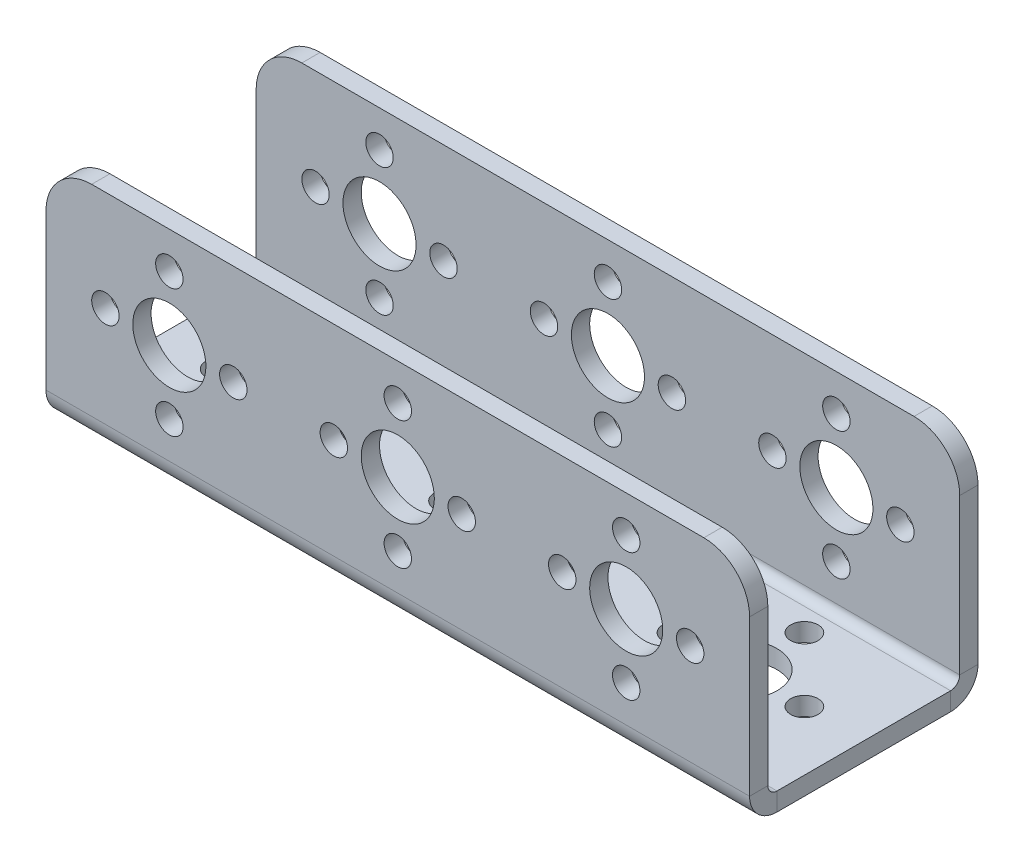
from build123d import *

# Parameters (mm, degrees)
T_LE_DE_BASE_PLI_E1_DEPTH              = 38.5
ESQUISSE7_W                            = 4
ESQUISSE7_H                            = 12.501
ESQUISSE12_W                           = 1.5
ESQUISSE12_H                           = 12.501
DIAM_TRE_DU_PER_AGE_3_0_3_1_AT_2_COUNT = 2
DIAM_TRE_DU_PER_AGE_3_0_3_1_AT_2_PITCH = 9.899494937
DIAM_TRE_DU_PER_AGE_3_0_3_1_AT_3_COUNT = 2
DIAM_TRE_DU_PER_AGE_3_0_3_1_AT_3_PITCH = 14
DIAM_TRE_DU_PER_AGE_3_0_3_1_AT_4_COUNT = 2
DIAM_TRE_DU_PER_AGE_3_0_3_1_AT_4_PITCH = 9.899494937
R_P_TITION_START                       = 10.5
R_P_TITION_CIRCULAIRE1_OUTLINE_R       = 4
R_P_TITION_CIRCULAIRE1_OUTLINE_R_2     = 1.5
R_P_TITION_CIRCULAIRE1_DEPTH           = 2
R_P_TITION_CIRCULAIRE1_2_OUTLINE_R     = 4
R_P_TITION_CIRCULAIRE1_2_OUTLINE_R_2   = 1.5
R_P_TITION_CIRCULAIRE1_2_DEPTH         = 2
R_P_TITION_LIN_AIRE1_COUNT             = 3
R_P_TITION_LIN_AIRE1_PITCH             = 25
R_P_TITION_LIN_AIRE1_COPY_1_SKETCH_W   = 1.5
R_P_TITION_LIN_AIRE1_COPY_1_SKETCH_H   = 12.501
R_P_TITION_LIN_AIRE1_COPY_2_SKETCH_W   = 1.5
R_P_TITION_LIN_AIRE1_COPY_2_SKETCH_H   = 12.501
R_P_TITION_LIN_AIRE1_COPY_3_SKETCH_W   = 1.5
R_P_TITION_LIN_AIRE1_COPY_3_SKETCH_H   = 12.501
R_P_TITION_LIN_AIRE1_COPY_4_SKETCH_W   = 1.5
R_P_TITION_LIN_AIRE1_COPY_4_SKETCH_H   = 12.501
R_P_TITION_LIN_AIRE1_COPY_5_SKETCH_W   = 1.5
R_P_TITION_LIN_AIRE1_COPY_5_SKETCH_H   = 12.501
R_P_TITION_LIN_AIRE1_COPY_6_SKETCH_W   = 1.5
R_P_TITION_LIN_AIRE1_COPY_6_SKETCH_H   = 12.501
CONG_1_R                               = 5


# Read off the part's stored shape, not the designer's step: Répétition circulaire1
# Sheet-metal steps are written as plain solids
with BuildPart() as part:
    # Esquisse1 → Tôle de base pliée1 (new, symmetric)
    with BuildSketch(Plane(origin=(0, 0, 0), x_dir=(0, 0, -1), z_dir=(1, 0, 0))):
        with BuildLine():
            Line((-12.5, 25), (-12.5, 3))
            ThreePointArc((-12.5, 3), (-11.621320344, 0.878679656), (-9.5, 0))
            Line((-9.5, 0), (9.5, 0))
            ThreePointArc((9.5, 0), (11.621320344, 0.878679656), (12.5, 3))
            Line((12.5, 3), (12.5, 25))
            Line((12.5, 25), (10.5, 25))
            Line((10.5, 25), (10.5, 3))
            ThreePointArc((10.5, 3), (10.207106781, 2.292893219), (9.5, 2))
            Line((9.5, 2), (-9.5, 2))
            ThreePointArc((-9.5, 2), (-10.207106781, 2.292893219), (-10.5, 3))
            Line((-10.5, 3), (-10.5, 25))
            Line((-10.5, 25), (-12.5, 25))
        make_face()
    extrude(amount=T_LE_DE_BASE_PLI_E1_DEPTH, both=True)

    # Esquisse7 → Diamètre du perçage Ø8.0 (8)1 (revolve, cut)
    with BuildSketch(Plane(origin=(25, 14, 0), x_dir=(0, -1, 0), z_dir=(1, 0, 0))):
        with Locations((2, 6.2505)):
            Rectangle(ESQUISSE7_W, ESQUISSE7_H)
    diam_tre_du_per_age_8_0_8_1 = revolve(axis=Axis((25, 14, 6.35), (0, 0, -1)), mode=Mode.SUBTRACT)

    # Esquisse12 → Diamètre du perçage Ø3.0 (3)1 (revolve, cut)
    with BuildSketch(Plane(origin=(25, 21, 0), x_dir=(0, -1, 0), z_dir=(1, 0, 0))):
        with Locations((0.75, 6.2505)):
            Rectangle(ESQUISSE12_W, ESQUISSE12_H)
    diam_tre_du_per_age_3_0_3_1 = revolve(axis=Axis((25, 21, 6.35), (0, 0, -1)), mode=Mode.SUBTRACT)

    # Diamètre du perçage Ø3.0 (3)1 at 2: Diamètre du perçage Ø3.0 (3)1 ×2
    with Locations(*[Vector(-0.7071067811865475, -0.7071067811865478, 0) * (i * DIAM_TRE_DU_PER_AGE_3_0_3_1_AT_2_PITCH) for i in range(1, DIAM_TRE_DU_PER_AGE_3_0_3_1_AT_2_COUNT)]):
        add(diam_tre_du_per_age_3_0_3_1, mode=Mode.SUBTRACT)

    # Diamètre du perçage Ø3.0 (3)1 at 3: Diamètre du perçage Ø3.0 (3)1 ×2
    with Locations(*[(0, -i * DIAM_TRE_DU_PER_AGE_3_0_3_1_AT_3_PITCH, 0) for i in range(1, DIAM_TRE_DU_PER_AGE_3_0_3_1_AT_3_COUNT)]):
        add(diam_tre_du_per_age_3_0_3_1, mode=Mode.SUBTRACT)

    # Diamètre du perçage Ø3.0 (3)1 at 4: Diamètre du perçage Ø3.0 (3)1 ×2
    with Locations(*[Vector(0.7071067811865476, -0.7071067811865476, 0) * (i * DIAM_TRE_DU_PER_AGE_3_0_3_1_AT_4_PITCH) for i in range(1, DIAM_TRE_DU_PER_AGE_3_0_3_1_AT_4_COUNT)]):
        add(diam_tre_du_per_age_3_0_3_1, mode=Mode.SUBTRACT)

    # Répétition circulaire1 outline → Répétition circulaire1 (cut)
    with BuildSketch(Plane.XY.offset(R_P_TITION_START)):
        with Locations((25, 14)):
            Circle(R_P_TITION_CIRCULAIRE1_OUTLINE_R)
        with Locations((32, 14)):
            Circle(R_P_TITION_CIRCULAIRE1_OUTLINE_R_2)
        with Locations((25, 7)):
            Circle(R_P_TITION_CIRCULAIRE1_OUTLINE_R_2)
        with Locations((18, 14)):
            Circle(R_P_TITION_CIRCULAIRE1_OUTLINE_R_2)
        with Locations((25, 21)):
            Circle(R_P_TITION_CIRCULAIRE1_OUTLINE_R_2)
    r_p_tition_circulaire1 = extrude(amount=R_P_TITION_CIRCULAIRE1_DEPTH, mode=Mode.SUBTRACT)

    # R_p_tition circulaire1 2 outline → R_p_tition circulaire1 2 (cut)
    with BuildSketch(Plane(origin=(0, 0, 0), x_dir=(1, 0, 0), z_dir=(0, 1, 0))):
        with Locations((25, 0)):
            Circle(R_P_TITION_CIRCULAIRE1_2_OUTLINE_R)
        with Locations((32, 0)):
            Circle(R_P_TITION_CIRCULAIRE1_2_OUTLINE_R_2)
        with Locations((25, -7)):
            Circle(R_P_TITION_CIRCULAIRE1_2_OUTLINE_R_2)
        with Locations((18, 0)):
            Circle(R_P_TITION_CIRCULAIRE1_2_OUTLINE_R_2)
        with Locations((25, 7)):
            Circle(R_P_TITION_CIRCULAIRE1_2_OUTLINE_R_2)
    r_p_tition_circulaire1_2 = extrude(amount=R_P_TITION_CIRCULAIRE1_2_DEPTH, mode=Mode.SUBTRACT)

    # Répétition linéaire1: Diamètre du perçage Ø8.0 (8)1, Diamètre du perçage Ø3.0 (3)1, Répétition circulaire1, R_p_tition circulaire1 2 ×3
    with Locations(*[(-i * R_P_TITION_LIN_AIRE1_PITCH, 0, 0) for i in range(1, R_P_TITION_LIN_AIRE1_COUNT)]):
        add(diam_tre_du_per_age_8_0_8_1, mode=Mode.SUBTRACT)
        add(diam_tre_du_per_age_3_0_3_1, mode=Mode.SUBTRACT)
        add(r_p_tition_circulaire1, mode=Mode.SUBTRACT)
        add(r_p_tition_circulaire1_2, mode=Mode.SUBTRACT)

    # Répétition linéaire1 copy 1 sketch → Répétition linéaire1 copy 1 (revolve, cut)
    with BuildSketch(Plane(origin=(-7, 14, 0), x_dir=(0, -1, 0), z_dir=(1, 0, 0))):
        with Locations((0.75, 6.2505)):
            Rectangle(R_P_TITION_LIN_AIRE1_COPY_1_SKETCH_W, R_P_TITION_LIN_AIRE1_COPY_1_SKETCH_H)
    revolve(axis=Axis((-7, 14, 6.35), (0, 0, -1)), mode=Mode.SUBTRACT)

    # Répétition linéaire1 copy 2 sketch → Répétition linéaire1 copy 2 (revolve, cut)
    with BuildSketch(Plane(origin=(-32, 14, 0), x_dir=(0, -1, 0), z_dir=(1, 0, 0))):
        with Locations((0.75, 6.2505)):
            Rectangle(R_P_TITION_LIN_AIRE1_COPY_2_SKETCH_W, R_P_TITION_LIN_AIRE1_COPY_2_SKETCH_H)
    revolve(axis=Axis((-32, 14, 6.35), (0, 0, -1)), mode=Mode.SUBTRACT)

    # Répétition linéaire1 copy 3 sketch → Répétition linéaire1 copy 3 (revolve, cut)
    with BuildSketch(Plane(origin=(0, 7, 0), x_dir=(0, -1, 0), z_dir=(1, 0, 0))):
        with Locations((0.75, 6.2505)):
            Rectangle(R_P_TITION_LIN_AIRE1_COPY_3_SKETCH_W, R_P_TITION_LIN_AIRE1_COPY_3_SKETCH_H)
    revolve(axis=Axis((0, 7, 6.35), (0, 0, -1)), mode=Mode.SUBTRACT)

    # Répétition linéaire1 copy 4 sketch → Répétition linéaire1 copy 4 (revolve, cut)
    with BuildSketch(Plane(origin=(-25, 7, 0), x_dir=(0, -1, 0), z_dir=(1, 0, 0))):
        with Locations((0.75, 6.2505)):
            Rectangle(R_P_TITION_LIN_AIRE1_COPY_4_SKETCH_W, R_P_TITION_LIN_AIRE1_COPY_4_SKETCH_H)
    revolve(axis=Axis((-25, 7, 6.35), (0, 0, -1)), mode=Mode.SUBTRACT)

    # Répétition linéaire1 copy 5 sketch → Répétition linéaire1 copy 5 (revolve, cut)
    with BuildSketch(Plane(origin=(7, 14, 0), x_dir=(0, -1, 0), z_dir=(1, 0, 0))):
        with Locations((0.75, 6.2505)):
            Rectangle(R_P_TITION_LIN_AIRE1_COPY_5_SKETCH_W, R_P_TITION_LIN_AIRE1_COPY_5_SKETCH_H)
    revolve(axis=Axis((7, 14, 6.35), (0, 0, -1)), mode=Mode.SUBTRACT)

    # Répétition linéaire1 copy 6 sketch → Répétition linéaire1 copy 6 (revolve, cut)
    with BuildSketch(Plane(origin=(-18, 14, 0), x_dir=(0, -1, 0), z_dir=(1, 0, 0))):
        with Locations((0.75, 6.2505)):
            Rectangle(R_P_TITION_LIN_AIRE1_COPY_6_SKETCH_W, R_P_TITION_LIN_AIRE1_COPY_6_SKETCH_H)
    revolve(axis=Axis((-18, 14, 6.35), (0, 0, -1)), mode=Mode.SUBTRACT)

    # Congé1
    cong_1_edges = [part.edges().sort_by_distance(p)[0] for p in [
        (-38.5, 25, 11.5),
        (-38.5, 25, -11.5),
        (38.5, 25, 11.5),
        (38.5, 25, -11.5),
    ]]
    fillet(cong_1_edges, radius=CONG_1_R)


solid = part.part
